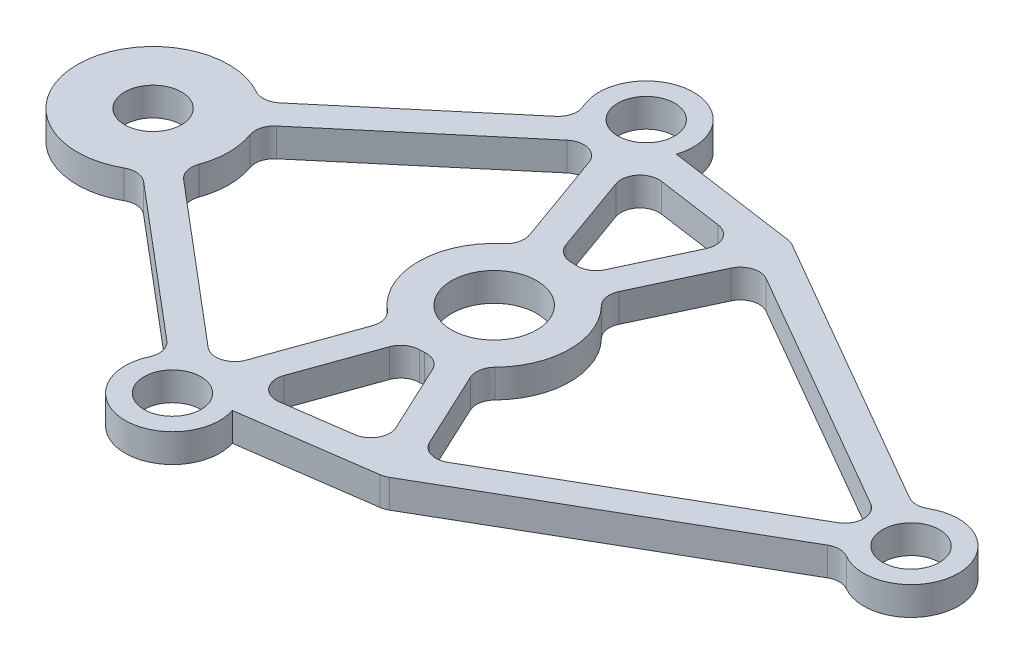
from build123d import *

# Parameters (mm, degrees)
SKETCH_1_R      = 1.5
SKETCH_1_R_2    = 2.25
EXTRUDE_1_DEPTH = 1.5


with BuildPart() as part:
    # 草图1 → 凸台-拉伸1 (new body)
    with BuildSketch(Plane(origin=(0, 0, 0), x_dir=(1, 0, 0), z_dir=(0, 1, 0))):
        with BuildLine():
            ThreePointArc((20.75, 2.165063509), (20.25, 2.031088913), (19.75, 2.165063509))
            Line((19.75, 2.165063509), (5.096488448, 10.625272348))
            ThreePointArc((5.096488448, 10.625272348), (4.922427124, 10.704637858), (4.736437674, 10.749405626))
            Line((4.736437674, 10.749405626), (-2.101908222, 11.7159388))
            ThreePointArc((-2.101908222, 11.7159388), (-4.61878361, 14.995906411), (-6.744553684, 11.449929699))
            ThreePointArc((-6.744553684, 11.449929699), (-6.675732942, 10.813623622), (-7.006838923, 10.265909693))
            Line((-7.006838923, 10.265909693), (-14.905573539, 3.595069524))
            ThreePointArc((-14.905573539, 3.595069524), (-15.456234647, 3.363542696), (-16.040639512, 3.487249128))
            ThreePointArc((-16.040639512, 3.487249128), (-22, 0), (-16.040639512, -3.487249128))
            ThreePointArc((-16.040639512, -3.487249128), (-15.456234647, -3.363542696), (-14.905573539, -3.595069524))
            Line((-14.905573539, -3.595069524), (-7.006838923, -10.265909693))
            ThreePointArc((-7.006838923, -10.265909693), (-6.675732942, -10.813623622), (-6.744553684, -11.449929699))
            ThreePointArc((-6.744553684, -11.449929699), (-4.61878361, -14.995906411), (-2.101908222, -11.7159388))
            Line((-2.101908222, -11.7159388), (4.736437674, -10.749405626))
            ThreePointArc((4.736437674, -10.749405626), (4.922427124, -10.704637858), (5.096488448, -10.625272348))
            Line((5.096488448, -10.625272348), (19.75, -2.165063509))
            ThreePointArc((19.75, -2.165063509), (20.25, -2.031088913), (20.75, -2.165063509))
            ThreePointArc((20.75, -2.165063509), (24.5, 0), (20.75, 2.165063509))
        make_face()
        with Locations((-4.47577596, -12.5)):
            Circle(SKETCH_1_R, mode=Mode.SUBTRACT)
        with BuildLine():
            ThreePointArc((-1.256530939, -10.081544307), (-2.171731289, -9.72303877), (-2.33794765, -8.754281823))
            Line((-2.33794765, -8.754281823), (-0.872808817, -4.662424773))
            ThreePointArc((-0.872808817, -4.662424773), (-0.512657064, -4.185850496), (0.054926934, -3.999622861))
            ThreePointArc((0.054926934, -3.999622861), (0.187612888, -3.995597753), (0.320092213, -3.987172052))
            ThreePointArc((0.320092213, -3.987172052), (0.902629068, -4.119395878), (1.305852753, -4.56012594))
            Line((1.305852753, -4.56012594), (2.997222742, -8.174556771))
            ThreePointArc((2.997222742, -8.174556771), (2.970810351, -9.074617878), (2.23143448, -9.588554578))
            Line((2.23143448, -9.588554578), (-1.256530939, -10.081544307))
        make_face(mode=Mode.SUBTRACT)
        with BuildLine():
            Line((-13.937734763, 2.449081695), (-5.622052564, 9.472053038))
            ThreePointArc((-5.622052564, 9.472053038), (-4.717022681, 9.673722513), (-4.035359228, 9.045164955))
            Line((-4.035359228, 9.045164955), (-2.285010045, 4.156769069))
            ThreePointArc((-2.285010045, 4.156769069), (-2.260804326, 3.559905256), (-2.581182025, 3.055732213))
            ThreePointArc((-2.581182025, 3.055732213), (-4, 0), (-2.581182025, -3.055732213))
            ThreePointArc((-2.581182025, -3.055732213), (-2.260804326, -3.559905256), (-2.285010045, -4.156769069))
            Line((-2.285010045, -4.156769069), (-4.035359228, -9.045164955))
            ThreePointArc((-4.035359228, -9.045164955), (-4.717022681, -9.673722513), (-5.622052564, -9.472053038))
            Line((-5.622052564, -9.472053038), (-13.937734763, -2.449081695))
            ThreePointArc((-13.937734763, -2.449081695), (-14.258158429, -1.944937864), (-14.23400713, -1.348071847))
            ThreePointArc((-14.23400713, -1.348071847), (-14, 0), (-14.23400713, 1.348071847))
            ThreePointArc((-14.23400713, 1.348071847), (-14.258158429, 1.944937864), (-13.937734763, 2.449081695))
        make_face(mode=Mode.SUBTRACT)
        with Locations((-18, 0)):
            Circle(SKETCH_1_R, mode=Mode.SUBTRACT)
        Circle(SKETCH_1_R_2, mode=Mode.SUBTRACT)
        with BuildLine():
            Line((-1.256530939, 10.081544307), (2.23143448, 9.588554578))
            ThreePointArc((2.23143448, 9.588554578), (2.970810351, 9.074617878), (2.997222742, 8.174556771))
            Line((2.997222742, 8.174556771), (1.305852753, 4.56012594))
            ThreePointArc((1.305852753, 4.56012594), (0.902629068, 4.119395878), (0.320092213, 3.987172052))
            ThreePointArc((0.320092213, 3.987172052), (0.187612888, 3.995597753), (0.054926934, 3.999622861))
            ThreePointArc((0.054926934, 3.999622861), (-0.512657064, 4.185850496), (-0.872808817, 4.662424773))
            Line((-0.872808817, 4.662424773), (-2.33794765, 8.754281823))
            ThreePointArc((-2.33794765, 8.754281823), (-2.171731289, 9.72303877), (-1.256530939, 10.081544307))
        make_face(mode=Mode.SUBTRACT)
        with Locations((-4.47577596, 12.5)):
            Circle(SKETCH_1_R, mode=Mode.SUBTRACT)
        with BuildLine():
            Line((5.956182941, 8.396876694), (19, 0.866025404))
            ThreePointArc((19, 0.866025404), (19.5, 0), (19, -0.866025404))
            Line((19, -0.866025404), (5.956182941, -8.396876694))
            ThreePointArc((5.956182941, -8.396876694), (5.156119776, -8.484770625), (4.550445454, -7.954690416))
            Line((4.550445454, -7.954690416), (2.664458984, -3.924367251))
            ThreePointArc((2.664458984, -3.924367251), (2.584431714, -3.332397688), (2.856157177, -2.800422501))
            ThreePointArc((2.856157177, -2.800422501), (4, 0), (2.856157177, 2.800422501))
            ThreePointArc((2.856157177, 2.800422501), (2.584431714, 3.332397688), (2.664458984, 3.924367251))
            Line((2.664458984, 3.924367251), (4.550445454, 7.954690416))
            ThreePointArc((4.550445454, 7.954690416), (5.156119776, 8.484770625), (5.956182941, 8.396876694))
        make_face(mode=Mode.SUBTRACT)
        with Locations((22, 0)):
            Circle(SKETCH_1_R, mode=Mode.SUBTRACT)
    extrude(amount=EXTRUDE_1_DEPTH)


solid = part.part
